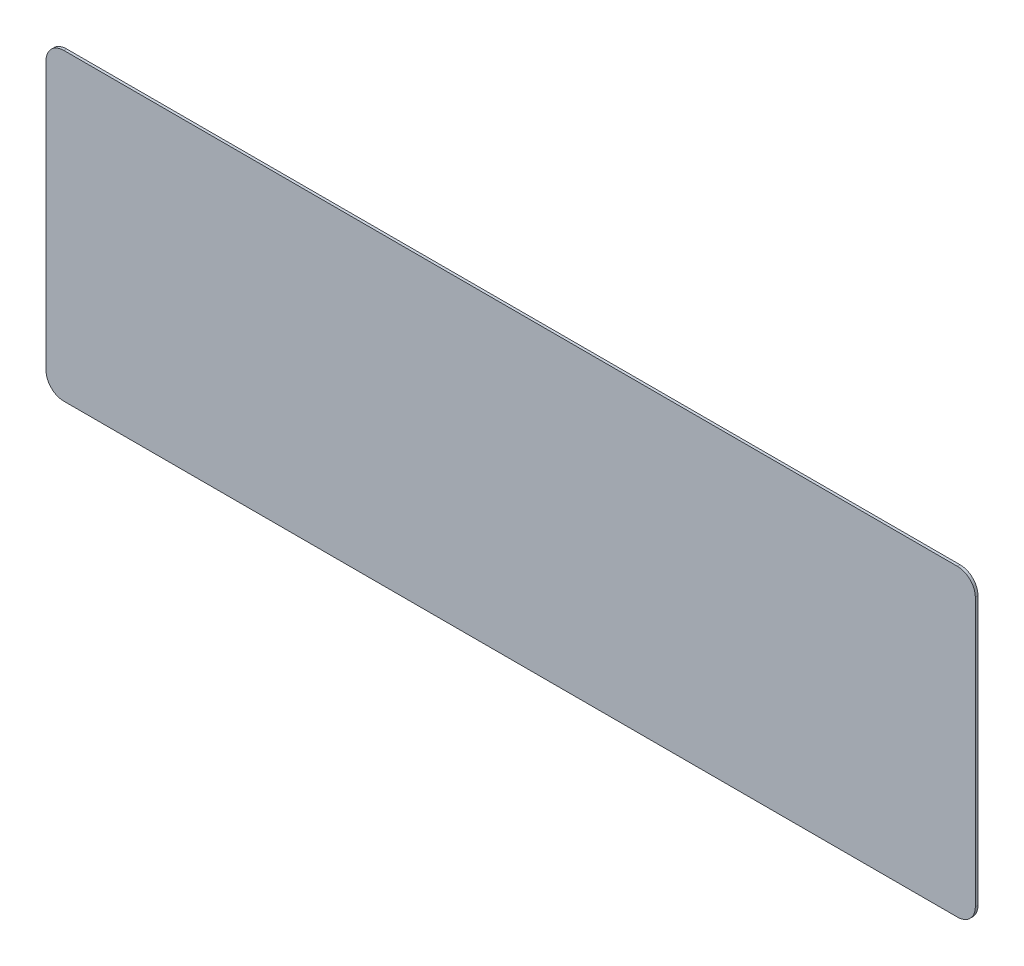
from build123d import *

# Parameters (mm, degrees)
SKETCH1_W          = 520
SKETCH1_H          = 170
BASE_FLANGE1_DEPTH = 1.5
FILLET1_R          = 10


# Sheet-metal steps are written as plain solids
with BuildPart() as part:
    # Sketch1 → Base-Flange1 (new body)
    with BuildSketch(Plane.XY):
        Rectangle(SKETCH1_W, SKETCH1_H)
    extrude(amount=-BASE_FLANGE1_DEPTH)

    # Fillet1
    fillet1_edges = [part.edges().sort_by_distance(p)[0] for p in [
        (-260, 85, -0.75),
        (260, 85, -0.75),
        (260, -85, -0.75),
        (-260, -85, -0.75),
    ]]
    fillet(fillet1_edges, radius=FILLET1_R)


solid = part.part
